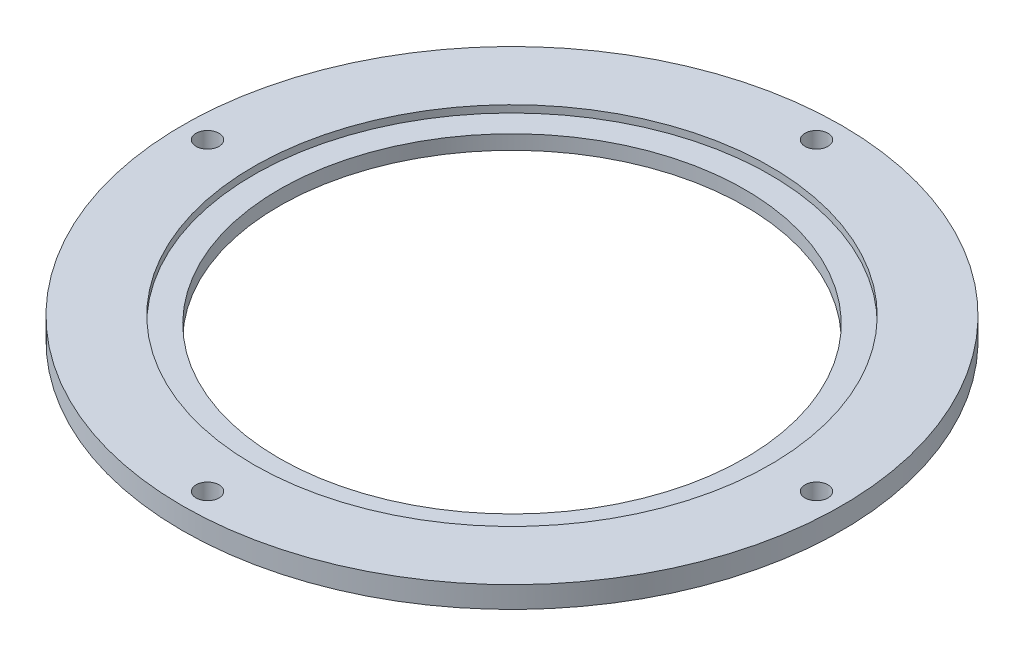
from build123d import *

# Parameters (mm, degrees)
SKETCH1_R            = 46
SKETCH1_R_2          = 36.05
BOSS_EXTRUDE1_DEPTH  = 3
SKETCH1_3_R          = 36.05
SKETCH1_3_R_2        = 32.5
BOSS_EXTRUDE2_DEPTH  = 2
M3_CLEARANCE_HOLE1_D = 3.2
CIRPATTERN1_COUNT    = 4


with BuildPart() as part:
    # Sketch1 → Boss-Extrude1 (new body)
    with BuildSketch(Plane(origin=(0, 0, 0), x_dir=(1, 0, 0), z_dir=(0, 1, 0))):
        Circle(SKETCH1_R)
        Circle(SKETCH1_R_2, mode=Mode.SUBTRACT)
    extrude(amount=BOSS_EXTRUDE1_DEPTH)

    # Sketch1<3> → Boss-Extrude2 (add)
    with BuildSketch(Plane(origin=(0, 0, 0), x_dir=(1, 0, 0), z_dir=(0, 1, 0))):
        Circle(SKETCH1_3_R)
        Circle(SKETCH1_3_R_2, mode=Mode.SUBTRACT)
    extrude(amount=BOSS_EXTRUDE2_DEPTH)

    # M3 Clearance Hole1 (through all)
    with Locations(Plane(origin=(0, 3, 0), x_dir=(1, 0, 0), z_dir=(0, 1, 0))):
        with Locations((-42.5, 0)):
            m3_clearance_hole1 = Hole(M3_CLEARANCE_HOLE1_D / 2)

    # CirPattern1: M3 Clearance Hole1 ×4 about axis
    cirpattern1_axis = Axis((0, 3, 0), (0, -1, 0))
    for i in range(1, CIRPATTERN1_COUNT):
        add(m3_clearance_hole1.rotate(cirpattern1_axis, i * 360 / CIRPATTERN1_COUNT), mode=Mode.SUBTRACT)


solid = part.part
